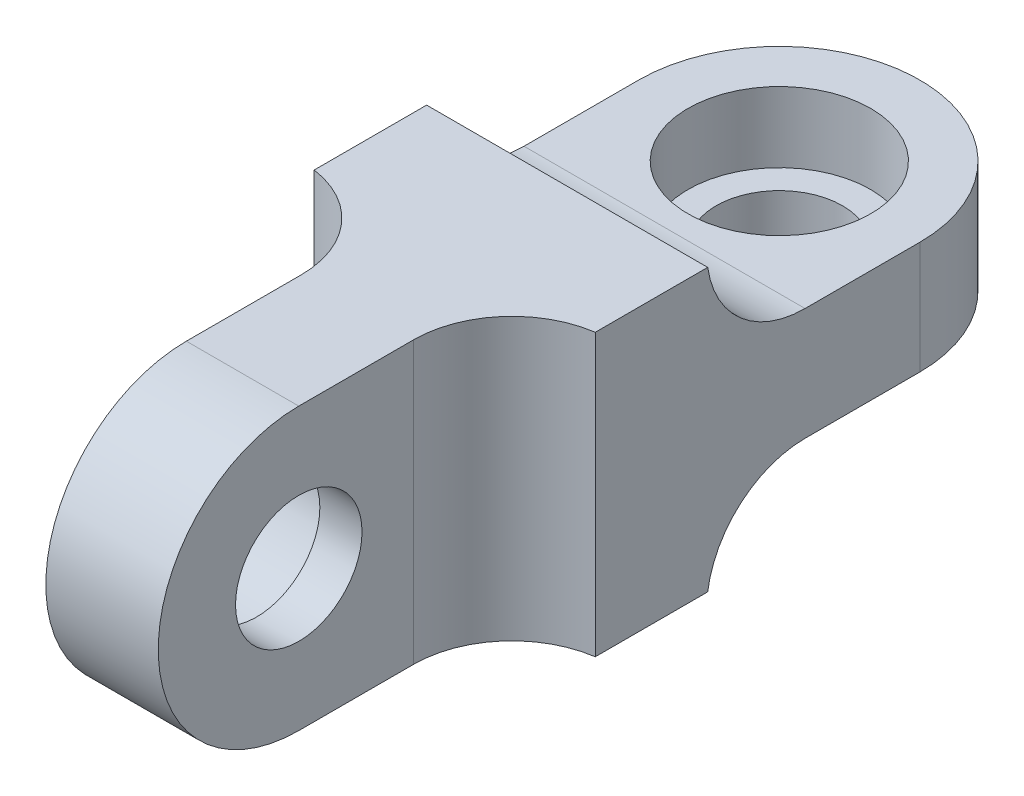
from build123d import *

# Parameters (mm, degrees)
SKETCH_1_W          = 20
SKETCH_1_H          = 20
EXTRUDE_1_DEPTH     = 60
SKETCH_7_W          = 26
SKETCH_7_H          = 6
CUT_EXTRUDE_6_DEPTH = 34
SKETCH_2_R          = 6.5
CUT_EXTRUDE_9_DEPTH = 5
SKETCH_3_R          = 4.5
CUT_EXTRUDE_2_DEPTH = 29
MOVE_BODY_1_ANGLE   = 90
SKETCH_8_W          = 20
SKETCH_8_H          = 20
EXTRUDE_2_DEPTH     = 8
FILLET_2_R          = 7


# Read off the part's stored shape, not the designer's step: 교차3
with BuildPart() as part:
    # 스케치1 → 보스-돌출1 (new body)
    with BuildSketch(Plane.XY):
        Rectangle(SKETCH_1_W, SKETCH_1_H)
    extrude(amount=EXTRUDE_1_DEPTH)

    # 스케치7 → 컷-돌출6 (cut)
    with BuildSketch(Plane(origin=(10, 0, 0), x_dir=(0, 0, -1), z_dir=(1, 0, 0))):
        with Locations((-13, 7)):
            Rectangle(SKETCH_7_W, SKETCH_7_H)
        with Locations((-13, -7)):
            Rectangle(SKETCH_7_W, SKETCH_7_H)
    cut_extrude_6 = extrude(amount=-CUT_EXTRUDE_6_DEPTH, mode=Mode.SUBTRACT)

    # 스케치2 → 컷-돌출9 (cut)
    with BuildSketch(Plane(origin=(0, 4, 0), x_dir=(-1, 0, 0), z_dir=(0, -1, 0))):
        with Locations(Location((0, -10.902706153, 0), (0, 0, 90))):
            Circle(SKETCH_2_R)
    cut_extrude_9 = extrude(amount=CUT_EXTRUDE_9_DEPTH, mode=Mode.SUBTRACT)

    # 스케치3 → 컷-돌출2 (cut)
    with BuildSketch(Plane(origin=(0, -4, 0), x_dir=(-1, 0, 0), z_dir=(0, -1, 0))):
        with Locations(Location((0, -10.902706153, 0), (0, 0, 90))):
            Circle(SKETCH_3_R)
        with BuildLine():
            Line((-21.262122506, -10.902706153), (-10, -10.902706153))
            ThreePointArc((-10, -10.902706153), (0, -0.902706153), (10, -10.902706153))
            Line((10, -10.902706153), (21.262122506, -10.902706153))
            ThreePointArc((21.262122506, -10.902706153), (0, 10.359416353), (-21.262122506, -10.902706153))
        make_face()
    cut_extrude_2 = extrude(amount=-CUT_EXTRUDE_2_DEPTH, mode=Mode.SUBTRACT)

    # 대칭 복사6: 컷-돌출6, 컷-돌출9, 컷-돌출2 across plane
    add(cut_extrude_6.mirror(Plane.XY.offset(30)), mode=Mode.SUBTRACT)
    add(cut_extrude_9.mirror(Plane.XY.offset(30)), mode=Mode.SUBTRACT)
    add(cut_extrude_2.mirror(Plane.XY.offset(30)), mode=Mode.SUBTRACT)


with BuildPart() as body_2:
    # 교차3: the piece on the far side of the plane
    add(part.part)
    split(bisect_by=Plane.XY.offset(30), keep=Keep.BOTTOM)


with BuildPart() as part_1:
    add(part.part)

    # 교차3
    split(bisect_by=Plane.XY.offset(30), keep=Keep.TOP)


with BuildPart() as part_2:
    # Move Body 1: moved
    add(part_1.part.rotate(Axis((0, 0, 0), (0, 0, 1)), MOVE_BODY_1_ANGLE))


    add(body_2.part)  # 보스-돌출2 merges body 2
    # 스케치8 → 보스-돌출2 (add)
    with BuildSketch(Plane.XY.offset(34)):
        Rectangle(SKETCH_8_W, SKETCH_8_H)
    extrude(amount=-EXTRUDE_2_DEPTH)

    # 필렛2
    # the kernel refuses this fillet: 7 mm, written as the material it adds along each edge
    with BuildSketch(Plane(origin=(-4, 10, 34), x_dir=(0, 0, 1), z_dir=(0, -1, 0)), Plane(origin=(10, -4, 26), x_dir=(0, 0, -1), z_dir=(-1, 0, 0))) as fillet_2_piece_1:
        with BuildLine():
            CenterArc((6.92820323, 7), FILLET_2_R, 188.213210702, 81.786789298)
            Line((0, 6), (-0.138564065, 5.98))
            ThreePointArc((-0.138564065, 5.98), (-0.14, 3), (-0.14, 0))
            Line((-0.14, 0), (0, -0.14))
            Line((0, -0.14), (6.92820323, -0.14))
            Line((6.92820323, -0.14), (6.92820323, 0))
        make_face()
    extrude(amount=20)
    with BuildSketch(Plane(origin=(4, 10, 34), x_dir=(1, 0, 0), z_dir=(0, -1, 0))) as fillet_2_piece_2:
        with BuildLine():
            CenterArc((7, 6.92820323), FILLET_2_R, 180, 81.786789298)
            Line((0, 6.92820323), (-0.14, 6.92820323))
            Line((-0.14, 6.92820323), (-0.14, 0))
            Line((-0.14, 0), (0, -0.14))
            ThreePointArc((0, -0.14), (3, -0.14), (5.98, -0.138564065))
            Line((5.98, -0.138564065), (6, 0))
        make_face()
    extrude(amount=20)
    with BuildSketch(Plane(origin=(10, 4, 26), x_dir=(0, 0, -1), z_dir=(-1, 0, 0))) as fillet_2_piece_3:
        with BuildLine():
            CenterArc((6.92820323, -7), FILLET_2_R, 90, 81.786789298)
            Line((0, -6), (-0.138564065, -5.98))
            ThreePointArc((-0.138564065, -5.98), (-0.14, -3), (-0.14, 0))
            Line((-0.14, 0), (0, 0.14))
            Line((0, 0.14), (6.92820323, 0.14))
            Line((6.92820323, 0.14), (6.92820323, 0))
        make_face()
    extrude(amount=20)


solid = part_2.part
